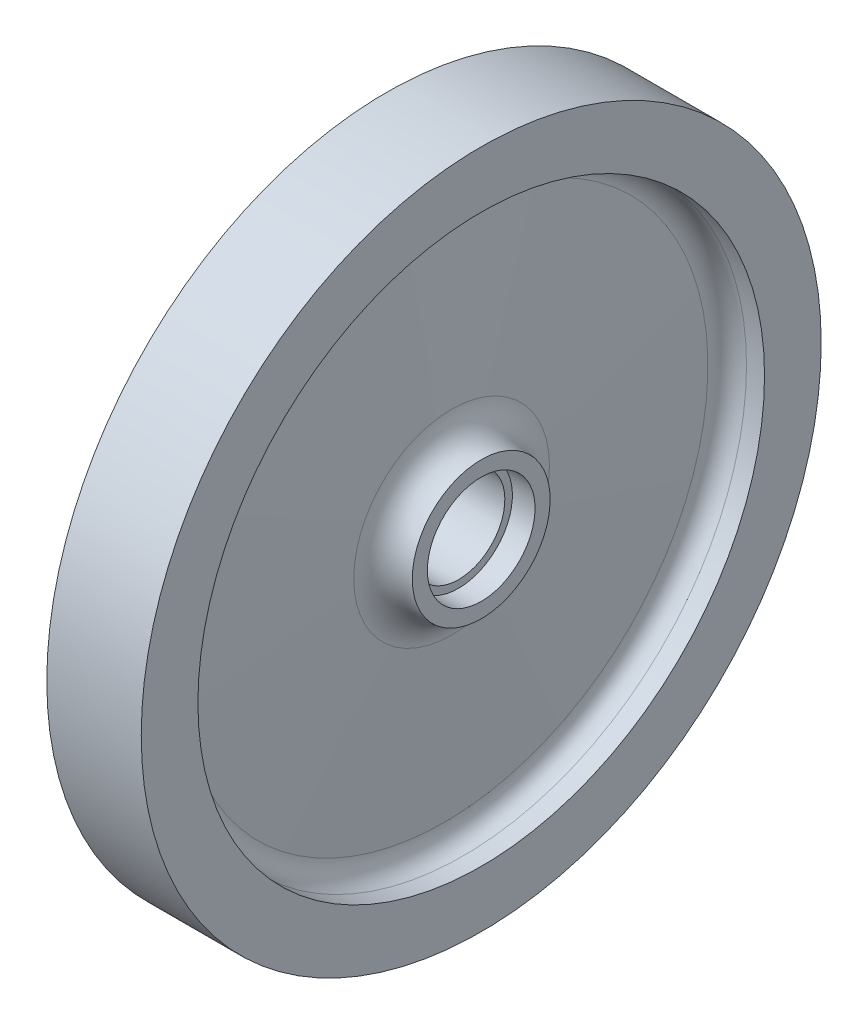
from build123d import *

# Parameters (mm, degrees)
FILLET1_R                      = 5
CUT_EXTRUDE1_REACH             = 129.892
CUT_EXTRUDE1_DIRECTION_2_REACH = 129.892


with BuildPart() as part:
    # Sketch1 → Revolve1 (revolve)
    with BuildSketch(Plane.XY, mode=Mode.PRIVATE) as revolve1_sk:
        Polygon((-2.5, 74.999999959), (-5, 18.25), (-12.5, 18.25), (-12.5, 14.25), (-6.5, 14.25), (-6.5, 12.25), (6.5, 12.25), (6.5, 14.25), (12.5, 14.25), (12.5, 18.25), (5, 18.25), (2.5, 74.999999959), (12.5, 74.999999959), (12.5, 89.999999959), (-12.5, 89.999999959), (-12.5, 74.999999959), align=None)
    revolve(revolve1_sk.sketch.rotate(Axis((-13.75, 0, 0), (1, 0, 0)), 90), axis=Axis((-13.75, 0, 0), (1, 0, 0)))

    # Fillet1
    fillet1_edges = [part.edges().sort_by_distance(p)[0] for p in [
        (-2.5, 0, -74.999999959),
        (2.5, 0, -74.999999959),
    ]]
    fillet(fillet1_edges, radius=FILLET1_R)

    # Fillet2: read off the stored shape, not the designer's step
    # Fillet2 outline → Fillet2 (revolve)
    with BuildSketch(Plane.YX):
        with BuildLine():
            Line((18.25, 12.5), (18.25, 4.663153786))
            Line((18.25, 4.663153786), (25.896409048, 4.663153786))
            ThreePointArc((25.896409048, 4.663153786), (20.522492538, 7.068547565), (18.25, 12.5))
        make_face()
        with BuildLine():
            Line((25.896409048, -4.663153786), (18.25, -4.663153786))
            Line((18.25, -4.663153786), (18.25, -12.5))
            ThreePointArc((18.25, -12.5), (20.522492538, -7.068547565), (25.896409048, -4.663153786))
        make_face()
    revolve(axis=Axis((0, 0, 0), (1, 0, 0)))

    # Sketch4 → Cut-Extrude1 (cut, up to next)
    with BuildSketch(Plane(origin=(0, 0, 0), x_dir=(0, 0, -1), z_dir=(1, 0, 0)), mode=Mode.PRIVATE) as cut_extrude1_sk1:
        with BuildLine():
            Line((-2.38125, 12.016328409), (-2.38125, 14.049631612))
            Line((-2.38125, 14.049631612), (2.38125, 14.049631612))
            Line((2.38125, 14.049631612), (2.38125, 12.016328409))
            ThreePointArc((2.38125, 12.016328409), (0, 12.25), (-2.38125, 12.016328409))
        make_face()
    cut_extrude1_tool1 = extrude(cut_extrude1_sk1.sketch, amount=-CUT_EXTRUDE1_REACH, mode=Mode.PRIVATE) & part.part
    add(cut_extrude1_tool1.solids().sort_by_distance((0, 13.109731, 0))[0], mode=Mode.SUBTRACT)

    # Sketch4 → Cut-Extrude1 direction 2 (cut, up to next)
    with BuildSketch(Plane(origin=(0, 0, 0), x_dir=(0, 0, -1), z_dir=(1, 0, 0)), mode=Mode.PRIVATE) as cut_extrude1_direction_2_sk1:
        with BuildLine():
            Line((-2.38125, 12.016328409), (-2.38125, 14.049631612))
            Line((-2.38125, 14.049631612), (2.38125, 14.049631612))
            Line((2.38125, 14.049631612), (2.38125, 12.016328409))
            ThreePointArc((2.38125, 12.016328409), (0, 12.25), (-2.38125, 12.016328409))
        make_face()
    cut_extrude1_direction_2_tool1 = extrude(cut_extrude1_direction_2_sk1.sketch, amount=CUT_EXTRUDE1_DIRECTION_2_REACH, mode=Mode.PRIVATE) & part.part
    add(cut_extrude1_direction_2_tool1.solids().sort_by_distance((0, 13.109731, 0))[0], mode=Mode.SUBTRACT)


solid = part.part
